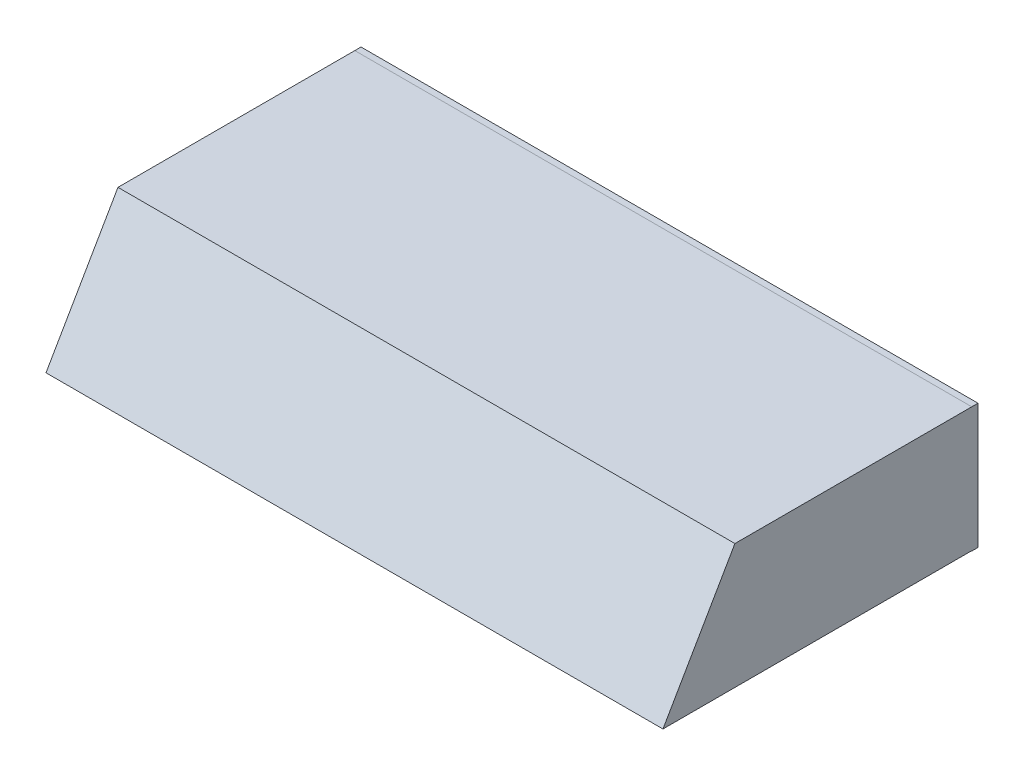
from build123d import *

# Parameters (mm, degrees)
BOSS_EXTRUDE1_DEPTH = 198
SHELL1_T            = -7
BOSS_EXTRUDE2_DEPTH = 191
SKETCH3_W           = 95.245639834
SKETCH3_H           = 3
BOSS_EXTRUDE3_DEPTH = 191
SKETCH4_R           = 1.585
CUT_EXTRUDE1_DEPTH  = 5
SKETCH6_W           = 198
SKETCH6_H           = 40.103607498
BOSS_EXTRUDE4_DEPTH = 2


with BuildPart() as part:
    # Sketch1 → Boss-Extrude1 (new body)
    with BuildSketch(Plane(origin=(0, 0, 0), x_dir=(0, 0, -1), z_dir=(1, 0, 0))):
        Polygon((22.10846405, 0), (32.441807929, 17.899216821), (45.200737204, 39.99998538), (121.214199537, 39.99998538), (121.18, 0), align=None)
    extrude(amount=BOSS_EXTRUDE1_DEPTH)

    # Shell1
    shell1_openings = [part.faces().sort_by_distance(p)[0] for p in [
        (99, 0, -71.644232025),
    ]]
    offset(amount=SHELL1_T, openings=shell1_openings, kind=Kind.INTERSECTION)

    # Sketch2 → Boss-Extrude2 (add)
    with BuildSketch(Plane.ZY):
        Polygon((-30.191216521, 0), (-32.974854852, 0), (-52.025978727, 32.99998538), (-49.242340395, 32.99998538), align=None)
    extrude(amount=-BOSS_EXTRUDE2_DEPTH)

    # Sketch3 → Boss-Extrude3 (add)
    with BuildSketch(Plane.ZY):
        with Locations((-73.557180083, 1.5)):
            Rectangle(SKETCH3_W, SKETCH3_H)
    extrude(amount=-BOSS_EXTRUDE3_DEPTH)

    # Sketch4 → Cut-Extrude1 (cut)
    with BuildSketch(Plane(origin=(0, 3, 0), x_dir=(1, 0, 0), z_dir=(0, 1, 0))):
        with Locations((11, 109.182562408)):
            Circle(SKETCH4_R)
        with Locations((11, 39.706775972)):
            Circle(SKETCH4_R)
    cut_extrude1 = extrude(amount=-CUT_EXTRUDE1_DEPTH, mode=Mode.SUBTRACT)

    # Mirror1: Cut-Extrude1 across plane
    add(cut_extrude1.mirror(Plane(origin=(99, 0, 0), x_dir=(0, 0, 1), z_dir=(1, 0, 0))), mode=Mode.SUBTRACT)

    # Sketch6 → Boss-Extrude4 (add)
    with BuildSketch(Plane(origin=(0, -0.10360746, -121.179911417), x_dir=(-1, 0, 0), z_dir=(0, -0.0008549884286730706, -0.9999996344973268))):
        with Locations((-99, 20.051803749)):
            Rectangle(SKETCH6_W, SKETCH6_H)
    extrude(amount=BOSS_EXTRUDE4_DEPTH)


solid = part.part
